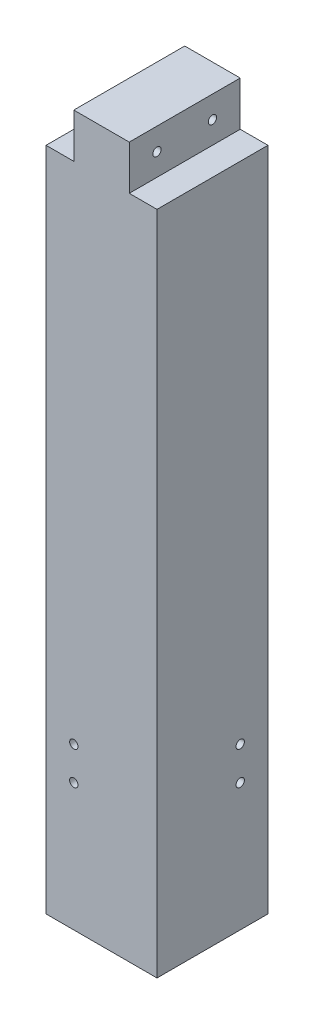
from build123d import *

# Parameters (mm, degrees)
BOSS_EXTRUDE1_DEPTH = 127
SKETCH4_W           = 31.75
SKETCH4_H           = 76.2
CUT_EXTRUDE3_DEPTH  = 63.5
SKETCH5_W           = 31.75
SKETCH5_H           = 76.2
CUT_EXTRUDE4_DEPTH  = 63.246
SKETCH7_R           = 4.7625
CUT_EXTRUDE6_DEPTH  = 69.85
SKETCH8_R           = 4.7625
CUT_EXTRUDE8_DEPTH  = 69.85
SKETCH9_R           = 4.7625
CUT_EXTRUDE9_DEPTH  = 461.057390442


with BuildPart() as part:
    # Sketch1 → Boss-Extrude1 (new body)
    with BuildSketch(Plane.XY):
        Polygon((63.5, -381), (63.5, 381), (31.75, 381), (31.75, 431.8), (-31.75, 431.8), (-31.75, 381), (-63.5, 381), (-63.5, -381), align=None)
    extrude(amount=-BOSS_EXTRUDE1_DEPTH)

    # Sketch4 → Cut-Extrude3 (cut)
    with BuildSketch(Plane.ZY.offset(63.5)):
        with Locations((-47.625, -215.9)):
            Rectangle(SKETCH4_W, SKETCH4_H)
    extrude(amount=-CUT_EXTRUDE3_DEPTH, mode=Mode.SUBTRACT)

    # Sketch5 → Cut-Extrude4 (cut)
    with BuildSketch(Plane(origin=(0, 0, -127), x_dir=(-1, 0, 0), z_dir=(0, 0, -1))):
        with Locations((-15.875, -215.9)):
            Rectangle(SKETCH5_W, SKETCH5_H)
    extrude(amount=-CUT_EXTRUDE4_DEPTH, mode=Mode.SUBTRACT)

    # Sketch7 → Cut-Extrude6 (cut)
    with BuildSketch(Plane(origin=(63.5, 0, 0), x_dir=(0, 0, -1), z_dir=(1, 0, 0))):
        with Locations((95.25, -196.85)):
            Circle(SKETCH7_R)
        with Locations((95.25, -234.95)):
            Circle(SKETCH7_R)
    extrude(amount=-CUT_EXTRUDE6_DEPTH, mode=Mode.SUBTRACT)

    # Sketch8 → Cut-Extrude8 (cut)
    with BuildSketch(Plane.XY):
        with Locations((-31.75, -196.85)):
            Circle(SKETCH8_R)
        with Locations((-31.75, -234.95)):
            Circle(SKETCH8_R)
    extrude(amount=-CUT_EXTRUDE8_DEPTH, mode=Mode.SUBTRACT)

    # Sketch9 → Cut-Extrude9 (cut, through all)
    with BuildSketch(Plane.ZY.offset(31.75)):
        with Locations((-95.25, 406.4)):
            Circle(SKETCH9_R)
        with Locations((-31.75, 406.4)):
            Circle(SKETCH9_R)
    extrude(amount=-CUT_EXTRUDE9_DEPTH, mode=Mode.SUBTRACT)


solid = part.part
